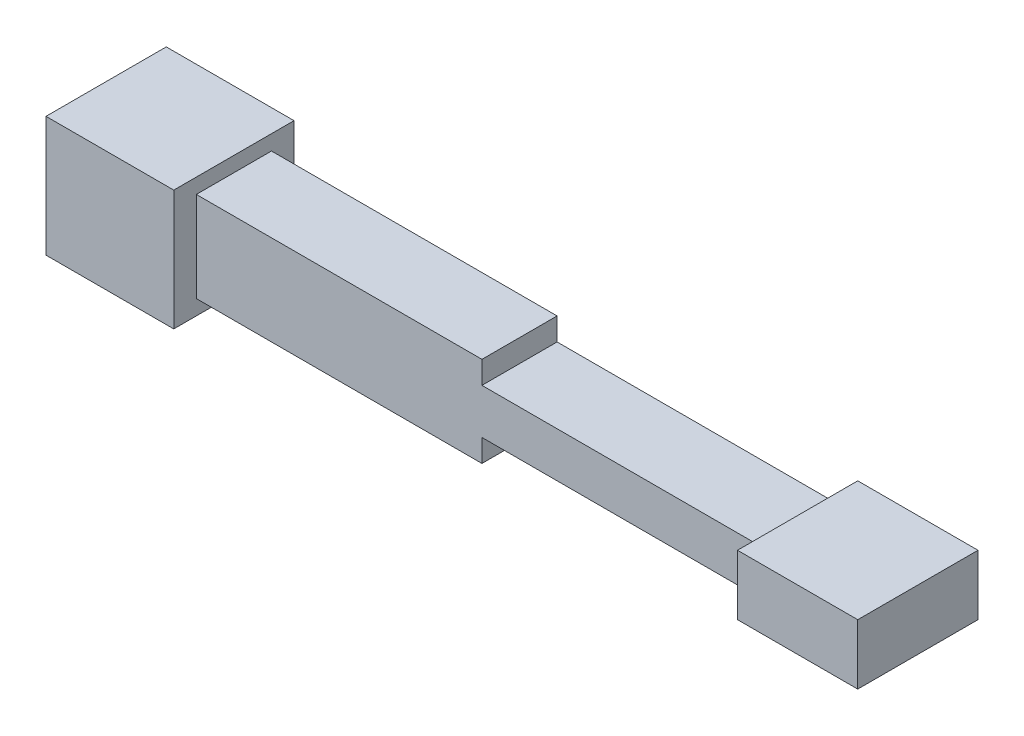
from build123d import *

# Parameters (mm, degrees)
SKETCH1_W             = 16
SKETCH1_H             = 8
BOSS_EXTRUDE1_DEPTH   = 8
SKETCH1_W_2           = 17
SKETCH1_H_2           = 16
BOSS_EXTRUDE1_2_DEPTH = 8
BOSS_EXTRUDE2_DEPTH   = 5


with BuildPart() as part:
    # Sketch1 → Boss-Extrude1 (new, symmetric)
    with BuildSketch(Plane.XY):
        with Locations((46, 0)):
            Rectangle(SKETCH1_W, SKETCH1_H)
    extrude(amount=BOSS_EXTRUDE1_DEPTH, both=True)



with BuildPart() as body_2:
    # Sketch1 → Boss-Extrude1 2 (new, symmetric)
    with BuildSketch(Plane.XY):
        with Locations((-45.5, 0)):
            Rectangle(SKETCH1_W_2, SKETCH1_H_2)
    extrude(amount=BOSS_EXTRUDE1_2_DEPTH, both=True)


with BuildPart() as part_1:
    add(part.part)

    add(body_2.part)  # Boss-Extrude2 merges body 2
    # Sketch1<3> → Boss-Extrude2 (add, symmetric)
    with BuildSketch(Plane.XY):
        Polygon((1, -3), (38, -3), (38, 3), (1, 3), (1, 6), (-37, 6), (-37, -6), (1, -6), align=None)
    extrude(amount=BOSS_EXTRUDE2_DEPTH, both=True)


solid = part_1.part
